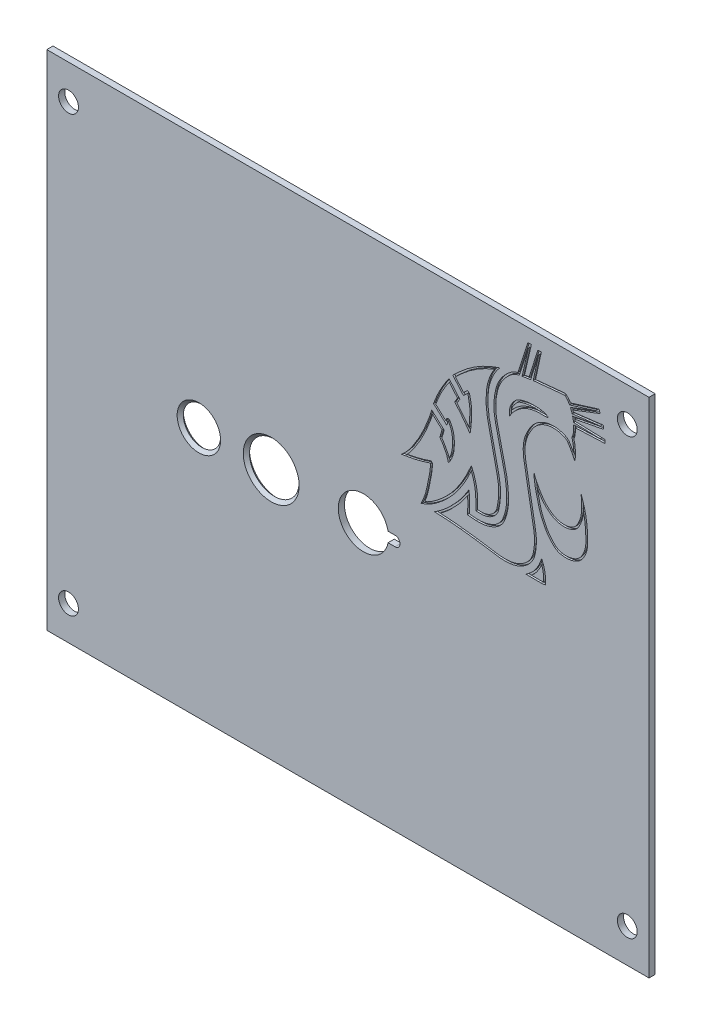
from build123d import *

# Parameters (mm, degrees)
SKETCH1_W           = 97
SKETCH1_H           = 81
BOSS_EXTRUDE1_DEPTH = 1
SKETCH2_R           = 1.6
CUT_EXTRUDE1_DEPTH  = 1
SKETCH4_R           = 4
SKETCH4_R_2         = 3
CUT_EXTRUDE3_DEPTH  = 139.622689341
CHAMFER1_SIZE       = 0.5
CHAMFER2_SIZE       = 0.5
CUT_EXTRUDE4_DEPTH  = 0.3


with BuildPart() as part:
    # Sketch1 → Boss-Extrude1 (new body)
    with BuildSketch(Plane.XY):
        with Locations((56.5, 50)):
            Rectangle(SKETCH1_W, SKETCH1_H)
    extrude(amount=BOSS_EXTRUDE1_DEPTH)

    # Sketch2 → Cut-Extrude1 (cut)
    with BuildSketch(Plane.XY.offset(1)):
        with Locations((11.5, 15)):
            Circle(SKETCH2_R)
        with Locations((101.5, 15)):
            Circle(SKETCH2_R)
        with Locations((101.5, 85)):
            Circle(SKETCH2_R)
        with Locations((11.5, 85)):
            Circle(SKETCH2_R)
    extrude(amount=-CUT_EXTRUDE1_DEPTH, mode=Mode.SUBTRACT)

    # Sketch4 → Cut-Extrude3 (cut, through all)
    with BuildSketch(Plane.XY.offset(1)):
        with Locations((44.15, 50)):
            Circle(SKETCH4_R)
        with Locations((32.5, 50)):
            Circle(SKETCH4_R_2)
        with BuildLine():
            Line((62.970201506, 50.8), (64.1, 50.8))
            ThreePointArc((64.1, 50.8), (64.9, 50), (64.1, 49.2))
            Line((64.1, 49.2), (62.970201506, 49.2))
            ThreePointArc((62.970201506, 49.2), (54.95, 50), (62.970201506, 50.8))
        make_face()
    extrude(amount=-CUT_EXTRUDE3_DEPTH, mode=Mode.SUBTRACT)

    # Chamfer1
    chamfer1_edges = [part.edges().sort_by_distance(p)[0] for p in [
        (29.5, 50, 1),
        (40.15, 50, 1),
    ]]
    chamfer(chamfer1_edges, length=CHAMFER1_SIZE)

    # Chamfer2
    chamfer2_edges = [part.edges().sort_by_distance(p)[0] for p in [
        (29.5, 50, 0),
        (40.15, 50, 0),
    ]]
    chamfer(chamfer2_edges, length=CHAMFER2_SIZE - 0.0001)  # a hair under: the kernel refuses the full size

    # Sketch5 → Cut-Extrude4 (cut)
    # profile 1 of 5: a face of its own
    with BuildSketch(Plane.XY.offset(1)):
        with BuildLine():
            Line((86.054305106, 88.379740448), (85.497866794, 88.379740448))
            Line((85.497866794, 88.379740448), (83.871970658, 83.393338948))
            ThreePointArc((83.871970658, 83.393338948), (83.216806685, 83.141680353), (82.620335426, 82.771823737))
            ThreePointArc((82.620335426, 82.771823737), (81.185374361, 81.247119649), (80.327658108, 79.337104297))
            ThreePointArc((80.327658108, 79.337104297), (80.012647539, 77.019418781), (80.259819093, 74.693520237))
            Line((80.259819093, 74.693520237), (81.481614781, 69.388253645))
            ThreePointArc((81.481614781, 69.388253645), (81.9273848, 67.150018272), (82.07682923, 64.872722759))
            ThreePointArc((82.07682923, 64.872722759), (81.926611137, 63.331978819), (81.481614781, 61.849266572))
            ThreePointArc((81.481614781, 61.849266572), (80.92436918, 60.960852537), (80.100867186, 60.311509311))
            ThreePointArc((80.100867186, 60.311509311), (78.700443247, 59.792193662), (77.210789737, 59.683527316))
            Line((77.210789737, 59.683527316), (76.05529719, 59.762600757))
            Line((76.05529719, 59.762600757), (76.127291401, 60.81464519))
            ThreePointArc((76.127291401, 60.81464519), (76.089435839, 61.958055188), (76.0063601, 63.099071353))
            Line((76.0063601, 63.099071353), (75.339761973, 62.070129341))
            Line((75.339761973, 62.070129341), (74.55071288, 60.993043019))
            Line((74.55071288, 60.993043019), (74.002202354, 60.352012646))
            Line((74.002202354, 60.352012646), (72.86913162, 59.162406256))
            Line((72.86913162, 59.162406256), (72.395368463, 58.726370171))
            Line((72.395368463, 58.726370171), (71.882471612, 58.294117479))
            Line((71.882471612, 58.294117479), (71.388929359, 57.907025516))
            Line((71.388929359, 57.907025516), (70.921891347, 57.577958219))
            Line((70.921891347, 57.577958219), (70.412431578, 57.262522148))
            Line((70.412431578, 57.262522148), (72.912133374, 57.13736378))
            Line((72.912133374, 57.13736378), (74.664956001, 56.966367935))
            Line((74.664956001, 56.966367935), (77.083764594, 56.675255368))
            Line((77.083764594, 56.675255368), (79.982708306, 56.248355124))
            ThreePointArc((79.982708306, 56.248355124), (81.296844778, 56.087015808), (82.620335426, 56.123860678))
            ThreePointArc((82.620335426, 56.123860678), (84.238260626, 56.57440774), (85.61569705, 57.535315385))
            ThreePointArc((85.61569705, 57.535315385), (86.269425106, 58.396310043), (86.652670728, 59.407148785))
            ThreePointArc((86.652670728, 59.407148785), (86.860099405, 61.122805872), (86.727490532, 62.845861525))
            Line((86.727490532, 62.845861525), (85.239156689, 71.245268969))
            ThreePointArc((85.239156689, 71.245268969), (85.085172441, 72.222826118), (85.033658239, 73.211095017))
            ThreePointArc((85.033658239, 73.211095017), (85.150991842, 74.327690105), (85.497866794, 75.395505413))
            ThreePointArc((85.497866794, 75.395505413), (85.838344813, 76.076998826), (86.23810347, 76.725498301))
            ThreePointArc((86.23810347, 76.725498301), (87.616428628, 77.990399787), (89.41440435, 78.507158251))
            ThreePointArc((89.41440435, 78.507158251), (90.431049366, 78.434063498), (91.400980424, 78.120784591))
            ThreePointArc((91.400980424, 78.120784591), (91.728456389, 77.905778234), (91.978831296, 77.604479966))
            Line((91.978831296, 77.604479966), (92.329632415, 77.025985631))
            Line((92.329632415, 77.025985631), (92.710052001, 76.336868426))
            Line((92.710052001, 76.336868426), (93.052029522, 75.644564604))
            Line((93.052029522, 75.644564604), (93.134114998, 76.201980953))
            Line((93.134114998, 76.201980953), (93.14298519, 76.510123371))
            Line((93.14298519, 76.510123371), (93.14298519, 76.681427028))
            Line((93.14298519, 76.681427028), (93.125826883, 77.202941561))
            Line((93.125826883, 77.202941561), (93.109333786, 77.499049722))
            Line((93.109333786, 77.499049722), (93.084107995, 77.842879963))
            Line((93.084107995, 77.842879963), (93.078932776, 77.881733564))
            Line((93.078932776, 77.881733564), (93.071230172, 77.922447329))
            Line((93.071230172, 77.922447329), (93.043801446, 78.026676487))
            Line((93.043801446, 78.026676487), (92.903206984, 78.654159175))
            Line((92.903206984, 78.654159175), (92.903206984, 78.684029469))
            Line((92.903206984, 78.684029469), (92.944107708, 78.763247152))
            Line((92.944107708, 78.763247152), (92.979593131, 78.858132086))
            Line((92.979593131, 78.858132086), (93.02433562, 78.996988087))
            Line((93.02433562, 78.996988087), (93.052029521, 79.096324993))
            Line((93.052029521, 79.096324993), (93.07443925, 79.218421613))
            Line((93.07443925, 79.218421613), (93.095474622, 79.350578628))
            Line((93.095474622, 79.350578628), (93.112694576, 79.499086415))
            Line((93.112694576, 79.499086415), (93.134828431, 79.742268013))
            Line((93.134828431, 79.742268013), (93.152229303, 79.953978629))
            Line((93.152229303, 79.953978629), (93.163210302, 80.314307838))
            Line((93.163210302, 80.314307838), (97.930703366, 80.513276294))
            Line((97.930703366, 80.513276294), (97.947416982, 81.055449597))
            Line((97.947416982, 81.055449597), (93.104292792, 81.204748936))
            Line((93.104292792, 81.204748936), (93.052029522, 81.475933494))
            Line((93.052029522, 81.475933494), (97.693970278, 82.370538263))
            Line((97.693970278, 82.370538263), (97.624501157, 82.933155947))
            Line((97.624501157, 82.933155947), (92.824034623, 82.340419174))
            Line((92.824034623, 82.340419174), (92.728313446, 82.587558631))
            Line((92.728313446, 82.587558631), (97.129639731, 84.292264708))
            Line((97.129639731, 84.292264708), (96.939370685, 84.813001046))
            Line((96.939370685, 84.813001046), (92.344255779, 83.393338949))
            Line((92.344255779, 83.393338949), (92.287228298, 83.497285668))
            Line((92.287228298, 83.497285668), (92.210697346, 83.623069212))
            Line((92.210697346, 83.623069212), (92.130767477, 83.739765478))
            Line((92.130767477, 83.739765478), (92.067488821, 83.821955676))
            Line((92.067488821, 83.821955676), (91.967557491, 83.920750809))
            Line((91.967557491, 83.920750809), (91.741949261, 84.14379392))
            Line((91.741949261, 84.14379392), (91.603672352, 84.258826373))
            ThreePointArc((91.603672352, 84.258826373), (91.563473588, 84.281938584), (91.518268653, 84.292264707))
            ThreePointArc((91.518268653, 84.292264707), (91.407846575, 84.295897879), (91.297521405, 84.290016379))
            Line((91.297521405, 84.290016379), (86.727490532, 83.848392607))
            Line((86.727490532, 83.848392607), (87.656231138, 88.139648889))
            Line((87.656231138, 88.139648889), (87.096169832, 88.139648889))
            Line((87.096169832, 88.139648889), (85.704268582, 83.699149241))
            Line((85.704268582, 83.699149241), (84.947739703, 83.577857926))
            Line((84.947739703, 83.577857926), (86.054305106, 88.379740448))
        make_face()
        with BuildLine():
            Line((84.106047188, 83.14348594), (85.585049511, 87.679384168))
            Line((85.585049511, 87.679384168), (84.555364181, 83.211118689))
            Line((84.555364181, 83.211118689), (85.935020273, 83.432313552))
            Line((85.935020273, 83.432313552), (87.21260559, 87.508117888))
            Line((87.21260559, 87.508117888), (86.347364482, 83.510261737))
            Line((86.347364482, 83.510261737), (91.326377409, 83.991407385))
            ThreePointArc((91.326377409, 83.991407385), (91.388681995, 83.995435819), (91.451116645, 83.995500152))
            Line((91.451116645, 83.995500152), (91.540190361, 83.921399797))
            Line((91.540190361, 83.921399797), (91.842151015, 83.622872373))
            Line((91.842151015, 83.622872373), (91.887971177, 83.563358336))
            Line((91.887971177, 83.563358336), (91.958615247, 83.460219182))
            Line((91.958615247, 83.460219182), (92.027444386, 83.347094062))
            Line((92.027444386, 83.347094062), (92.198962745, 83.034459341))
            Line((92.198962745, 83.034459341), (96.412654355, 84.336280599))
            Line((96.412654355, 84.336280599), (92.340212036, 82.758956692))
            Line((92.340212036, 82.758956692), (92.628735781, 82.01402643))
            Line((92.628735781, 82.01402643), (97.165381374, 82.574187957))
            Line((97.165381374, 82.574187957), (92.700678305, 81.713740816))
            Line((92.700678305, 81.713740816), (92.855136165, 80.912287193))
            Line((92.855136165, 80.912287193), (97.135307031, 80.780342057))
            Line((97.135307031, 80.780342057), (92.871850891, 80.602409279))
            Line((92.871850891, 80.602409279), (92.852604068, 79.970846277))
            Line((92.852604068, 79.970846277), (92.83594429, 79.768152312))
            Line((92.83594429, 79.768152312), (92.814264985, 79.529964803))
            Line((92.814264985, 79.529964803), (92.79820408, 79.391452843))
            Line((92.79820408, 79.391452843), (92.778727028, 79.269086144))
            Line((92.778727028, 79.269086144), (92.759407028, 79.163823528))
            Line((92.759407028, 79.163823528), (92.73696041, 79.083308413))
            Line((92.73696041, 79.083308413), (92.696174672, 78.956731986))
            Line((92.696174672, 78.956731986), (92.669360955, 78.885034437))
            Line((92.669360955, 78.885034437), (92.603206984, 78.756905549))
            Line((92.603206984, 78.756905549), (92.603206984, 78.620961565))
            Line((92.603206984, 78.620961565), (92.752270186, 77.955682314))
            Line((92.752270186, 77.955682314), (92.778421375, 77.856307797))
            Line((92.778421375, 77.856307797), (92.782639966, 77.834009531))
            Line((92.782639966, 77.834009531), (92.78556191, 77.812072671))
            Line((92.78556191, 77.812072671), (92.809944843, 77.479730673))
            Line((92.809944843, 77.479730673), (92.826101355, 77.189665369))
            Line((92.826101355, 77.189665369), (92.841574614, 76.719366687))
            Line((92.841574614, 76.719366687), (92.589319304, 77.176318642))
            Line((92.589319304, 77.176318642), (92.235351624, 77.760034848))
            ThreePointArc((92.235351624, 77.760034848), (91.928340024, 78.129489058), (91.526786525, 78.393131475))
            ThreePointArc((91.526786525, 78.393131475), (90.48832383, 78.728545477), (89.399846546, 78.806804827))
            ThreePointArc((89.399846546, 78.806804827), (87.469663822, 78.252048582), (85.989989001, 76.894137591))
            ThreePointArc((85.989989001, 76.894137591), (85.576210812, 76.222895246), (85.223792233, 75.517501867))
            ThreePointArc((85.223792233, 75.517501867), (84.85754477, 74.390050475), (84.733658239, 73.211095017))
            ThreePointArc((84.733658239, 73.211095017), (84.786539721, 72.194111862), (84.944613779, 71.188098055))
            Line((84.944613779, 71.188098055), (86.432092165, 62.793518382))
            ThreePointArc((86.432092165, 62.793518382), (86.560170392, 61.129331753), (86.359828616, 59.472290915))
            ThreePointArc((86.359828616, 59.472290915), (86.007003503, 58.541688523), (85.405165775, 57.74903619))
            ThreePointArc((85.405165775, 57.74903619), (84.110382621, 56.845787946), (82.589541255, 56.422276025))
            ThreePointArc((82.589541255, 56.422276025), (81.30720421, 56.386861673), (80.034042682, 56.544030999))
            Line((80.034042682, 56.544030999), (77.123548662, 56.972632149))
            Line((77.123548662, 56.972632149), (74.69744788, 57.264622357))
            Line((74.69744788, 57.264622357), (72.934210726, 57.436634187))
            Line((72.934210726, 57.436634187), (71.35443244, 57.515732611))
            Line((71.35443244, 57.515732611), (71.568014331, 57.666218896))
            Line((71.568014331, 57.666218896), (72.071765939, 58.061318197))
            Line((72.071765939, 58.061318197), (72.59370824, 58.501194098))
            Line((72.59370824, 58.501194098), (73.079555161, 58.948351683))
            Line((73.079555161, 58.948351683), (74.224947388, 60.150894358))
            Line((74.224947388, 60.150894358), (74.786023971, 60.806610365))
            Line((74.786023971, 60.806610365), (75.586859963, 61.899786316))
            Line((75.586859963, 61.899786316), (75.775590608, 62.191105602))
            ThreePointArc((75.775590608, 62.191105602), (75.809559967, 61.507297651), (75.827152787, 60.822872547))
            Line((75.827152787, 60.822872547), (75.735515289, 59.483782653))
            Line((75.735515289, 59.483782653), (77.190307838, 59.384227313))
            ThreePointArc((77.190307838, 59.384227313), (78.764143497, 59.499034528), (80.243707113, 60.047697342))
            ThreePointArc((80.243707113, 60.047697342), (81.147590696, 60.760422612), (81.759228742, 61.735554266))
            ThreePointArc((81.759228742, 61.735554266), (82.220961428, 63.274031379), (82.37682923, 64.872722759))
            ThreePointArc((82.37682923, 64.872722759), (82.225163894, 67.186552466), (81.772763228, 69.460787265))
            Line((81.772763228, 69.460787265), (80.552166566, 74.760847462))
            ThreePointArc((80.552166566, 74.760847462), (80.31261553, 77.01503649), (80.617914043, 79.261265706))
            ThreePointArc((80.617914043, 79.261265706), (81.434893368, 81.08056556), (82.80170147, 82.53285437))
            ThreePointArc((82.80170147, 82.53285437), (83.421488005, 82.907349288), (84.106047188, 83.14348594))
        make_face(mode=Mode.SUBTRACT)
    # profile 2 of 5: a face of its own
    with BuildSketch(Plane.XY.offset(1)):
        with BuildLine():
            Line((82.52956802, 77.322832458), (82.52956802, 76.618441849))
            ThreePointArc((82.52956802, 76.618441849), (84.560120292, 78.707450731), (87.37051847, 79.474759482))
            Line((87.37051847, 79.474759482), (88.408111135, 79.474759482))
            ThreePointArc((88.408111135, 79.474759482), (88.521131429, 79.480858928), (88.632838854, 79.499086415))
            ThreePointArc((88.632838854, 79.499086415), (88.68200988, 79.529534995), (88.701230826, 79.584082782))
            Line((88.701230826, 79.584082782), (88.701230826, 79.613393627))
            ThreePointArc((88.701230826, 79.613393627), (88.659725951, 79.673185585), (88.601573953, 79.716958612))
            ThreePointArc((88.601573953, 79.716958612), (88.314993015, 79.850257127), (88.0164315, 79.953978629))
            ThreePointArc((88.0164315, 79.953978629), (87.460785394, 80.074091656), (86.893736005, 80.114399528))
            Line((86.893736005, 80.114399528), (86.520666384, 80.114399528))
            ThreePointArc((86.520666384, 80.114399528), (85.634309904, 80.072406423), (84.763925786, 79.899713866))
            Line((84.763925786, 79.899713866), (84.398912326, 79.798643169))
            ThreePointArc((84.398912326, 79.798643169), (83.904254691, 79.60140749), (83.477786146, 79.282483252))
            ThreePointArc((83.477786146, 79.282483252), (83.117627234, 78.876995189), (82.818548782, 78.424571614))
            ThreePointArc((82.818548782, 78.424571614), (82.603014814, 77.892336419), (82.52956802, 77.322832458))
        make_face()
        with BuildLine():
            ThreePointArc((83.687369823, 79.067833112), (84.052293294, 79.34047161), (84.475651872, 79.508603711))
            Line((84.475651872, 79.508603711), (84.843982188, 79.610592831))
            ThreePointArc((84.843982188, 79.610592831), (85.672679696, 79.774863247), (86.516576142, 79.814399528))
            Line((86.516576142, 79.814399528), (86.893736005, 79.814399528))
            ThreePointArc((86.893736005, 79.814399528), (87.164859313, 79.804476241), (87.43453177, 79.774759482))
            Line((87.43453177, 79.774759482), (87.37051847, 79.774759482))
            ThreePointArc((87.37051847, 79.774759482), (84.871078467, 79.211844839), (82.854268541, 77.631797073))
            ThreePointArc((82.854268541, 77.631797073), (82.938500467, 77.964557761), (83.079926705, 78.277324946))
            ThreePointArc((83.079926705, 78.277324946), (83.355507485, 78.694202996), (83.687369823, 79.067833112))
        make_face(mode=Mode.SUBTRACT)
    # profile 3 of 5: a face of its own
    with BuildSketch(Plane.XY.offset(1)):
        with BuildLine():
            Line((86.552994067, 70.492480127), (86.438998528, 70.894516946))
            ThreePointArc((86.438998528, 70.894516946), (86.563194788, 69.508744798), (86.826169967, 68.142496938))
            Line((86.826169967, 68.142496938), (87.211039807, 66.573448755))
            ThreePointArc((87.211039807, 66.573448755), (87.453298946, 65.705862606), (87.795750713, 64.872722759))
            Line((87.795750713, 64.872722759), (88.320849006, 63.782428231))
            ThreePointArc((88.320849006, 63.782428231), (88.967051291, 62.828808867), (89.773397186, 62.006146371))
            ThreePointArc((89.773397186, 62.006146371), (90.243663081, 61.695090646), (90.77481427, 61.505923814))
            ThreePointArc((90.77481427, 61.505923814), (91.8700385, 61.416392612), (92.947588719, 61.63183976))
            ThreePointArc((92.947588719, 61.63183976), (93.744324312, 62.062336289), (94.367046485, 62.719855841))
            ThreePointArc((94.367046485, 62.719855841), (94.924398302, 63.865824507), (95.125863794, 65.124115763))
            ThreePointArc((95.125863794, 65.124115763), (95.103515038, 66.407431738), (95.006250497, 67.687251634))
            ThreePointArc((95.006250497, 67.687251634), (94.722717266, 69.387390961), (94.237109702, 71.041189654))
            Line((94.237109702, 71.041189654), (94.040191671, 71.58779725))
            ThreePointArc((94.040191671, 71.58779725), (94.14091883, 70.543485403), (94.162150246, 69.494541925))
            ThreePointArc((94.162150246, 69.494541925), (93.96635631, 68.175637968), (93.438923738, 66.951032809))
            ThreePointArc((93.438923738, 66.951032809), (92.947588719, 66.393338894), (92.287228298, 66.052227889))
            ThreePointArc((92.287228298, 66.052227889), (90.827940239, 65.944165955), (89.45850195, 66.459760555))
            ThreePointArc((89.45850195, 66.459760555), (88.452025659, 67.289838495), (87.656231138, 68.323634893))
            ThreePointArc((87.656231138, 68.323634893), (87.147422002, 69.217645789), (86.6858988, 70.136959965))
            ThreePointArc((86.6858988, 70.136959965), (86.612202872, 70.312012173), (86.552994067, 70.492480127))
        make_face()
        with BuildLine():
            ThreePointArc((89.967921678, 62.234532496), (89.201954931, 63.015460637), (88.58739271, 63.920373393))
            Line((88.58739271, 63.920373393), (88.066037485, 65.002895954))
            ThreePointArc((88.066037485, 65.002895954), (87.736346856, 65.805301485), (87.503380279, 66.64093126))
            Line((87.503380279, 66.64093126), (87.117532835, 68.213964967))
            ThreePointArc((87.117532835, 68.213964967), (87.035230062, 68.570270206), (86.962599048, 68.928672084))
            ThreePointArc((86.962599048, 68.928672084), (87.176868438, 68.546194874), (87.399457352, 68.16849875))
            ThreePointArc((87.399457352, 68.16849875), (88.23635954, 67.081300429), (89.294826504, 66.208343872))
            ThreePointArc((89.294826504, 66.208343872), (90.785161126, 65.647231707), (92.373277607, 65.764833532))
            ThreePointArc((92.373277607, 65.764833532), (93.132159853, 66.156836258), (93.696799117, 66.797734769))
            ThreePointArc((93.696799117, 66.797734769), (94.217629725, 67.968184289), (94.451196195, 69.227812529))
            ThreePointArc((94.451196195, 69.227812529), (94.601878107, 68.445446208), (94.707905013, 67.655787806))
            ThreePointArc((94.707905013, 67.655787806), (94.803841173, 66.393446924), (94.825884704, 65.127657711))
            ThreePointArc((94.825884704, 65.127657711), (94.638309064, 63.956118182), (94.119383353, 62.889157268))
            ThreePointArc((94.119383353, 62.889157268), (93.561819663, 62.30043722), (92.848450433, 61.914985659))
            ThreePointArc((92.848450433, 61.914985659), (91.852682114, 61.715890118), (90.840581174, 61.798626248))
            ThreePointArc((90.840581174, 61.798626248), (90.377722954, 61.963470881), (89.967921678, 62.234532496))
        make_face(mode=Mode.SUBTRACT)
    # profile 4 of 5: a face of its own
    with BuildSketch(Plane.XY.offset(1)):
        with BuildLine():
            ThreePointArc((88.334068747, 56.447402393), (88.193892619, 57.94847719), (87.697014198, 59.371848797))
            Line((87.697014198, 59.371848797), (87.565549219, 58.98156214))
            ThreePointArc((87.565549219, 58.98156214), (87.179430931, 58.084698923), (86.652670728, 57.262522148))
            ThreePointArc((86.652670728, 57.262522148), (85.963818187, 56.518574803), (85.146225194, 55.918977293))
            Line((85.146225194, 55.918977293), (87.615840772, 55.905883097))
            ThreePointArc((87.615840772, 55.905883097), (87.970371295, 55.923456686), (88.320849006, 55.979724767))
            Line((88.320849006, 55.979724767), (88.334068747, 56.447402393))
        make_face()
        with BuildLine():
            Line((87.617431386, 56.20587888), (86.071109318, 56.214077664))
            ThreePointArc((86.071109318, 56.214077664), (86.504254672, 56.625504779), (86.891235137, 57.080623761))
            ThreePointArc((86.891235137, 57.080623761), (87.35413122, 57.779974896), (87.719831547, 58.53471198))
            ThreePointArc((87.719831547, 58.53471198), (87.969941346, 57.509348398), (88.034188527, 56.455879042))
            Line((88.034188527, 56.455879042), (88.027873969, 56.232487568))
            ThreePointArc((88.027873969, 56.232487568), (87.823118791, 56.21199336), (87.617431386, 56.20587888))
        make_face(mode=Mode.SUBTRACT)
    # profile 5 of 5: a face of its own
    with BuildSketch(Plane.XY.offset(1)):
        with BuildLine():
            Line((75.116273476, 75.792489231), (75.791419442, 76.437159859))
            ThreePointArc((75.791419442, 76.437159859), (75.81079767, 76.411520876), (75.823814503, 76.382136609))
            Line((75.823814503, 76.382136609), (75.926487115, 75.912272437))
            Line((75.926487115, 75.912272437), (76.05529719, 75.190186825))
            ThreePointArc((76.05529719, 75.190186825), (76.120238114, 74.702554612), (76.141941413, 74.211096104))
            ThreePointArc((76.141941413, 74.211096104), (76.104142475, 72.99733087), (75.990892153, 71.788269595))
            Line((75.990892153, 71.788269595), (75.541413096, 72.433047823))
            Line((75.541413096, 72.433047823), (74.935310952, 73.211095017))
            Line((74.935310952, 73.211095017), (74.59573578, 73.622428672))
            Line((74.59573578, 73.622428672), (74.373342916, 73.86324858))
            Line((74.373342916, 73.86324858), (74.060676938, 74.225180875))
            Line((74.060676938, 74.225180875), (74.524208005, 74.998592702))
            Line((74.524208005, 74.998592702), (72.801868496, 76.992318708))
            Line((72.801868496, 76.992318708), (72.211528123, 76.170710973))
            Line((72.211528123, 76.170710973), (71.481550407, 74.930755854))
            Line((71.481550407, 74.930755854), (71.357014337, 74.702658211))
            Line((71.357014337, 74.702658211), (71.259226274, 74.510546704))
            ThreePointArc((71.259226274, 74.510546704), (70.740484956, 73.402588643), (70.29583857, 72.262872357))
            Line((70.29583857, 72.262872357), (72.423721143, 70.334034488))
            Line((72.423721143, 70.334034488), (72.675264441, 71.041189654))
            ThreePointArc((72.675264441, 71.041189654), (72.714607166, 71.015481118), (72.737874171, 70.974646998))
            Line((72.737874171, 70.974646998), (72.958362995, 70.492480127))
            ThreePointArc((72.958362995, 70.492480127), (73.238006081, 69.653334415), (73.332665973, 68.773899774))
            Line((73.332665973, 68.773899774), (73.332665973, 67.978540765))
            ThreePointArc((73.332665973, 67.978540765), (73.198254007, 66.91705961), (72.803502896, 65.922584685))
            Line((72.803502896, 65.922584685), (72.737874171, 66.14451459))
            ThreePointArc((72.737874171, 66.14451459), (72.657245083, 66.364937722), (72.549492792, 66.573448756))
            Line((72.549492792, 66.573448756), (72.255522697, 67.144126349))
            ThreePointArc((72.255522697, 67.144126349), (71.965520157, 67.655723771), (71.635542464, 68.142496938))
            Line((71.635542464, 68.142496938), (72.009291506, 69.420504137))
            Line((72.009291506, 69.420504137), (70.000832062, 71.224225385))
            Line((70.000832062, 71.224225385), (69.775538085, 70.505843641))
            ThreePointArc((69.775538085, 70.505843641), (69.683590754, 70.231000073), (69.581300096, 69.959836064))
            Line((69.581300096, 69.959836064), (69.52989688, 69.815114969))
            ThreePointArc((69.52989688, 69.815114969), (68.368195895, 67.108583186), (66.869739961, 64.572938635))
            ThreePointArc((66.869739961, 64.572938635), (66.079273106, 63.553192292), (65.169637264, 62.638160551))
            Line((65.169637264, 62.638160551), (65.798366463, 62.734000457))
            ThreePointArc((65.798366463, 62.734000457), (67.828933379, 63.140071634), (69.813482129, 63.731393932))
            ThreePointArc((69.813482129, 63.731393932), (69.828628769, 63.672509766), (69.833725398, 63.61192272))
            Line((69.833725398, 63.61192272), (69.683590754, 62.326006779))
            Line((69.683590754, 62.326006779), (69.249227106, 60.126044967))
            ThreePointArc((69.249227106, 60.126044967), (68.871864233, 58.719412112), (68.309507332, 57.375993546))
            ThreePointArc((68.309507332, 57.375993546), (69.402372851, 57.795733393), (70.412431577, 58.38761003))
            ThreePointArc((70.412431577, 58.38761003), (71.471301921, 59.193421581), (72.464538344, 60.078870657))
            ThreePointArc((72.464538344, 60.078870657), (73.802762804, 61.550870674), (74.935310951, 63.186402224))
            Line((74.935310951, 63.186402224), (75.339761972, 63.861801007))
            Line((75.339761972, 63.861801007), (75.791419441, 64.682238396))
            Line((75.791419441, 64.682238396), (76.378731263, 65.922584685))
            ThreePointArc((76.378731263, 65.922584685), (76.921572459, 64.123155138), (77.104842896, 62.252584314))
            Line((77.104842896, 62.252584314), (77.104842896, 60.711120358))
            Line((77.104842896, 60.711120358), (78.016462409, 60.711120358))
            ThreePointArc((78.016462409, 60.711120358), (78.328451157, 60.726319102), (78.637485249, 60.771771395))
            ThreePointArc((78.637485249, 60.771771395), (79.035944383, 60.87938231), (79.415790856, 61.04083338))
            ThreePointArc((79.415790856, 61.04083338), (79.972636738, 61.413093064), (80.4267043, 61.905512863))
            ThreePointArc((80.4267043, 61.905512863), (80.653242427, 62.294213779), (80.798970804, 62.719855841))
            ThreePointArc((80.798970804, 62.719855841), (81.086522324, 65.116042488), (80.836915189, 67.516478407))
            Line((80.836915189, 67.516478407), (79.268620179, 74.693520237))
            Line((79.268620179, 74.693520237), (79.077402027, 76.28973541))
            ThreePointArc((79.077402027, 76.28973541), (79.064199016, 76.419752353), (79.061774922, 76.550415466))
            Line((79.061774922, 76.550415466), (79.093029132, 77.922447329))
            ThreePointArc((79.093029132, 77.922447329), (79.452020577, 79.915604037), (80.327658107, 81.741749551))
            Line((80.327658107, 81.741749551), (80.525750495, 82.0430698))
            Line((80.525750495, 82.0430698), (80.964871614, 82.587558631))
            ThreePointArc((80.964871614, 82.587558631), (77.552804918, 81.075398559), (74.55071288, 78.858132086))
            Line((74.55071288, 78.858132086), (73.39217895, 77.788246791))
            Line((73.39217895, 77.788246791), (75.116273476, 75.792489231))
        make_face()
        with BuildLine():
            ThreePointArc((76.114894538, 76.455352475), (75.967662779, 76.681936271), (75.71575446, 76.77970951))
            Line((75.71575446, 76.77970951), (75.137154225, 76.227226647))
            Line((75.137154225, 76.227226647), (73.808921924, 77.764746554))
            Line((73.808921924, 77.764746554), (74.754245116, 78.63773556))
            ThreePointArc((74.754245116, 78.63773556), (77.279302508, 80.560899023), (80.121375584, 81.974084493))
            Line((80.121375584, 81.974084493), (80.076977753, 81.906550523))
            ThreePointArc((80.076977753, 81.906550523), (79.16607641, 80.006369443), (78.793177876, 77.932393532))
            Line((78.793177876, 77.932393532), (78.761852728, 76.557247545))
            ThreePointArc((78.761852728, 76.557247545), (78.764628388, 76.403620581), (78.779929445, 76.250732301))
            Line((78.779929445, 76.250732301), (78.972462357, 74.643542015))
            Line((78.972462357, 74.643542015), (80.543830844, 67.452434929))
            ThreePointArc((80.543830844, 67.452434929), (80.78653171, 65.118415607), (80.506936326, 62.788527986))
            ThreePointArc((80.506936326, 62.788527986), (80.380399505, 62.41894044), (80.183695096, 62.081429111))
            ThreePointArc((80.183695096, 62.081429111), (79.777635748, 61.641072479), (79.279664753, 61.308171526))
            ThreePointArc((79.279664753, 61.308171526), (78.937925569, 61.16291769), (78.579441, 61.066102612))
            ThreePointArc((78.579441, 61.066102612), (78.299290953, 61.024898543), (78.016462409, 61.011120358))
            Line((78.016462409, 61.011120358), (77.404842896, 61.011120358))
            Line((77.404842896, 61.011120358), (77.404842896, 62.252584314))
            ThreePointArc((77.404842896, 62.252584314), (77.146582379, 64.503439682), (76.385224109, 66.63730518))
            Line((76.385224109, 66.63730518), (75.524196715, 64.81889783))
            Line((75.524196715, 64.81889783), (75.079581809, 64.011253281))
            Line((75.079581809, 64.011253281), (74.677930645, 63.340530022))
            ThreePointArc((74.677930645, 63.340530022), (73.567940986, 61.737575557), (72.256371744, 60.294895347))
            ThreePointArc((72.256371744, 60.294895347), (71.280503016, 59.424929201), (70.240148041, 58.633208042))
            ThreePointArc((70.240148041, 58.633208042), (69.57945913, 58.223439773), (68.876730356, 57.890885806))
            ThreePointArc((68.876730356, 57.890885806), (69.265856775, 58.962343751), (69.543545231, 60.06793437))
            Line((69.543545231, 60.06793437), (69.980196925, 62.279484662))
            Line((69.980196925, 62.279484662), (70.133421915, 63.59186968))
            ThreePointArc((70.133421915, 63.59186968), (70.084315349, 63.863007437), (69.929173991, 64.090731607))
            ThreePointArc((69.929173991, 64.090731607), (68.013880725, 63.496770252), (66.052744296, 63.078341892))
            ThreePointArc((66.052744296, 63.078341892), (66.611368651, 63.720199952), (67.117696702, 64.404067516))
            ThreePointArc((67.117696702, 64.404067516), (68.635721787, 66.97282643), (69.812594058, 69.714704285))
            Line((69.812594058, 69.714704285), (69.862088963, 69.854052702))
            ThreePointArc((69.862088963, 69.854052702), (69.967212026, 70.133188515), (70.061791213, 70.41607089))
            Line((70.061791213, 70.41607089), (70.147481146, 70.689305374))
            Line((70.147481146, 70.689305374), (71.668349048, 69.323471596))
            Line((71.668349048, 69.323471596), (71.305324444, 68.08213582))
            ThreePointArc((71.305324444, 68.08213582), (71.671423616, 67.559915468), (71.988827413, 67.006745034))
            Line((71.988827413, 67.006745034), (72.287421001, 66.427091958))
            ThreePointArc((72.287421001, 66.427091958), (72.380702829, 66.248533833), (72.450189482, 66.059440976))
            Line((72.450189482, 66.059440976), (72.699787619, 65.215400636))
            ThreePointArc((72.699787619, 65.215400636), (73.393154315, 66.520356501), (73.632665973, 67.978540765))
            Line((73.632665973, 67.978540765), (73.632665973, 68.773899774))
            ThreePointArc((73.632665973, 68.773899774), (73.531134236, 69.717177075), (73.231190427, 70.617240668))
            Line((73.231190427, 70.617240668), (73.016861487, 71.085937051))
            ThreePointArc((73.016861487, 71.085937051), (72.780743211, 71.322047499), (72.447781283, 71.296821741))
            Line((72.447781283, 71.296821741), (72.291855471, 70.85847278))
            Line((72.291855471, 70.85847278), (70.645962478, 72.350406956))
            ThreePointArc((70.645962478, 72.350406956), (71.055670373, 73.375746666), (71.526583175, 74.374457441))
            Line((71.526583175, 74.374457441), (71.62240366, 74.562703503))
            Line((71.62240366, 74.562703503), (71.742537144, 74.782737462))
            Line((71.742537144, 74.782737462), (72.463127074, 76.006746295))
            Line((72.463127074, 76.006746295), (72.823529107, 76.508336753))
            Line((72.823529107, 76.508336753), (74.155330634, 74.966685223))
            Line((74.155330634, 74.966685223), (73.691799567, 74.193273396))
            Line((73.691799567, 74.193273396), (74.149573431, 73.66336878))
            Line((74.149573431, 73.66336878), (74.369688473, 73.425015429))
            Line((74.369688473, 73.425015429), (74.701256633, 73.023380814))
            Line((74.701256633, 73.023380814), (75.29985905, 72.254960945))
            Line((75.29985905, 72.254960945), (76.178917358, 70.993950784))
            ThreePointArc((76.178917358, 70.993950784), (76.376075883, 72.597156385), (76.441941413, 74.211096104))
            ThreePointArc((76.441941413, 74.211096104), (76.419070275, 74.728999639), (76.350634928, 75.242870988))
            Line((76.350634928, 75.242870988), (76.2208078, 75.970658007))
            Line((76.2208078, 75.970658007), (76.114894538, 76.455352475))
        make_face(mode=Mode.SUBTRACT)
    extrude(amount=-CUT_EXTRUDE4_DEPTH, mode=Mode.SUBTRACT)


solid = part.part
